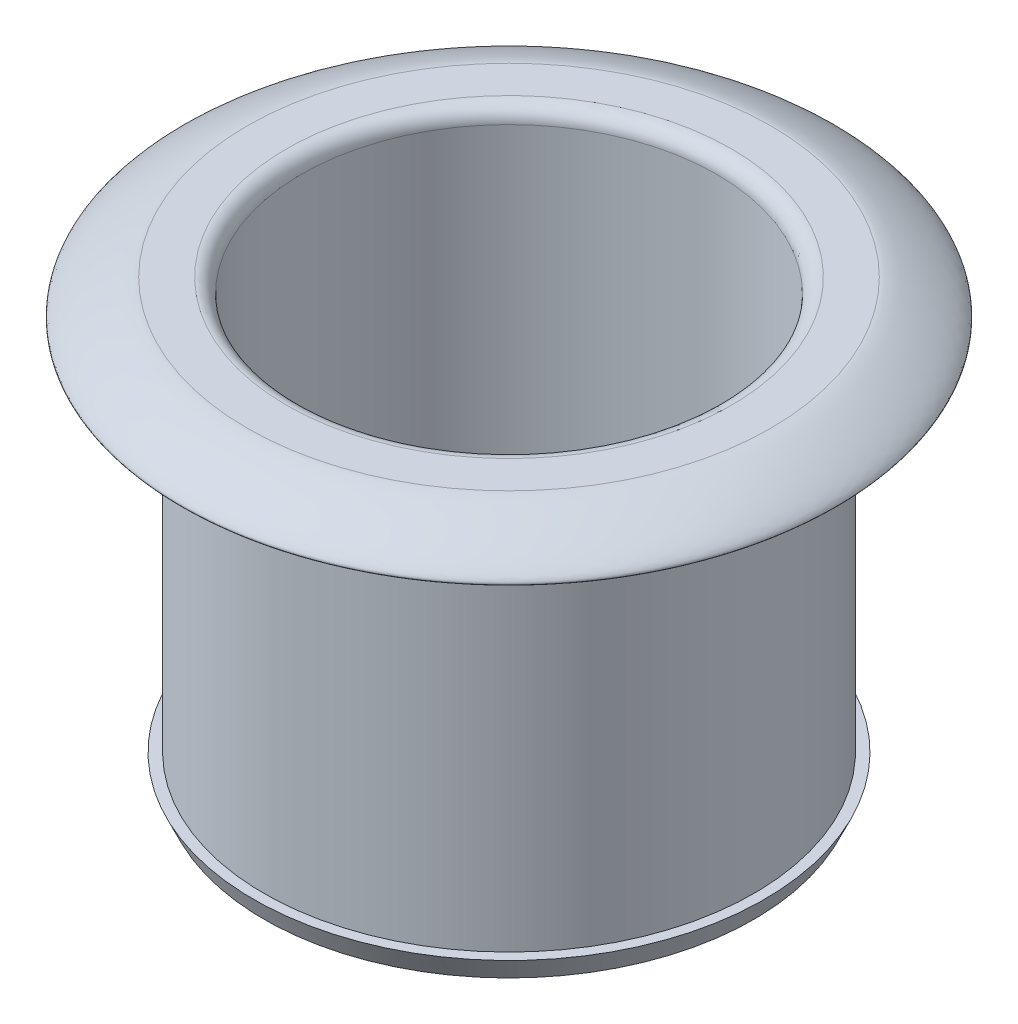
from build123d import *

# Parameters (mm, degrees)
FILLET1_R = 1


with BuildPart() as part:
    # Sketch1 → Revolve1 (revolve)
    with BuildSketch(Plane.XY):
        with BuildLine():
            Line((14.097, 29.464), (14.097, 0))
            Line((14.097, 0), (16.637, 0))
            Line((16.637, 0), (17.337, 1.524))
            Line((17.337, 1.524), (16.637, 1.524))
            Line((16.637, 1.524), (16.637, 26.924))
            Line((16.637, 26.924), (21.717, 26.924))
            add(Edge.make_bspline(
                [(17.78437931, 29.464), (18.912312817, 29.464), (23.777747907, 26.924), (21.717, 26.924)],
                knots=[0, 0, 0, 0, 1, 1, 1, 1], degree=3))
            Line((17.78437931, 29.464), (14.097, 29.464))
        make_face()
    revolve(axis=Axis((0, 0, 0), (0, 1, 0)))

    # Fillet1
    fillet1_edges = [part.edges().sort_by_distance(p)[0] for p in [
        (-14.097, 0, 0),
        (-14.097, 29.464, 0),
    ]]
    fillet(fillet1_edges, radius=FILLET1_R)


solid = part.part
